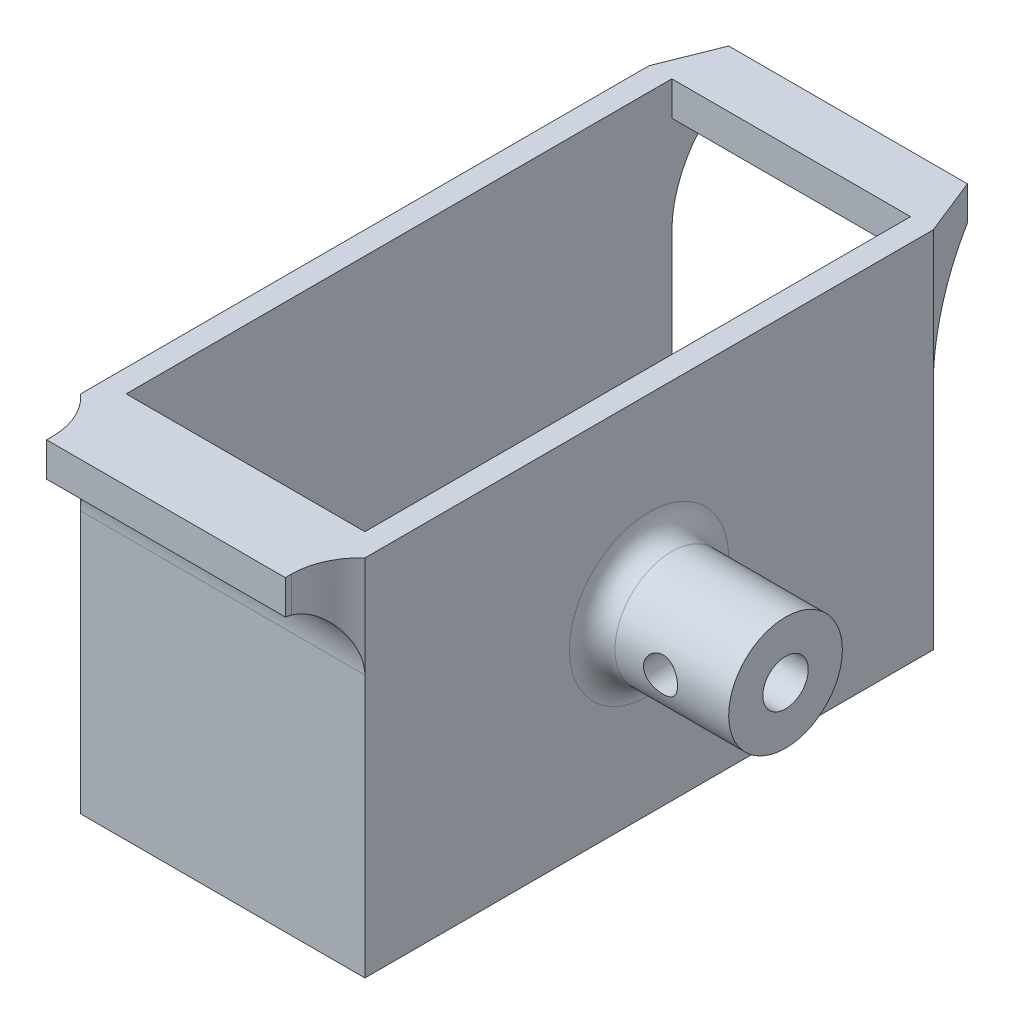
from build123d import *

# Parameters (mm, degrees)
BOSS_EXTRUDE1_DEPTH      = 29
BOSS_EXTRUDE1_DEPTH_BACK = 3
SKETCH1_W                = 25
SKETCH1_H                = 50
BOSS_EXTRUDE2_DEPTH      = 3
BOSS_EXTRUDE3_START      = 29
SKETCH1_4_W              = 21
SKETCH1_4_H              = 5
BOSS_EXTRUDE3_DEPTH      = 3
CUT_EXTRUDE1_DEPTH       = 29
FILLET1_START            = -12.900995056
FILLET1_DEPTH            = 2
FILLET1_START_2          = 10.099004944
FILLET1_2_DEPTH          = 2
FILLET1_START_3          = 16
FILLET1_3_DEPTH          = 10
FILLET2_R                = 6
SKETCH2_R                = 5
SKETCH2_R_2              = 2
BOSS_EXTRUDE4_DEPTH      = 12
CUT_EXTRUDE3_DEPTH       = 30
FILLET5_R                = 2


with BuildPart() as part:
    # Sketch1 → Boss-Extrude1 (new, two sides: drawn at the far end of the back side and taken through both)
    with BuildSketch(Plane(origin=(0, 0, 0), x_dir=(1, 0, 0), z_dir=(0, 1, 0)).offset(-BOSS_EXTRUDE1_DEPTH_BACK)):
        with Locations((-0.400995056, -2.5)):
            Rectangle(SKETCH1_W, SKETCH1_H)
    extrude(amount=BOSS_EXTRUDE1_DEPTH + BOSS_EXTRUDE1_DEPTH_BACK)

    # Sketch1<3> → Boss-Extrude2 (add)
    with BuildSketch(Plane(origin=(0, 0, 0), x_dir=(1, 0, 0), z_dir=(0, 1, 0))):
        Polygon((-10.900995056, 22.5), (-10.900995056, 20.5), (-10.900995056, -25.5), (10.099004944, -25.5), (10.099004944, 20.5), (10.099004944, 22.5), align=None)
    extrude(amount=-BOSS_EXTRUDE2_DEPTH)

    # Sketch1<4> → Boss-Extrude3 (add)
    with BuildSketch(Plane(origin=(0, 0, 0), x_dir=(1, 0, 0), z_dir=(0, 1, 0)).offset(BOSS_EXTRUDE3_START)):
        Polygon((-12.900995056, 22.5), (12.099004944, 22.5), (10.099004944, 27.5), (-10.900995056, 27.5), align=None)
        with Locations((-0.400995056, -30)):
            Rectangle(SKETCH1_4_W, SKETCH1_4_H)
    extrude(amount=-BOSS_EXTRUDE3_DEPTH)

    # Sketch1<5> → Cut-Extrude1 (cut)
    with BuildSketch(Plane(origin=(0, 0, 0), x_dir=(1, 0, 0), z_dir=(0, 1, 0))):
        Polygon((-10.900995056, 22.5), (10.099004944, 22.5), (10.099004944, 20.5), (10.099004944, -25.5), (-10.900995056, -25.5), (-10.900995056, 20.5), align=None)
    extrude(amount=CUT_EXTRUDE1_DEPTH, mode=Mode.SUBTRACT)

    # Fillet1: read off the stored shape, not the designer's step
    # Fillet1 outline → Fillet1 (add)
    with BuildSketch(Plane.YZ.offset(FILLET1_START)):
        with BuildLine():
            ThreePointArc((17.339745962, -22.5), (22.339745962, -23.839745962), (26, -27.5))
            Line((26, -27.5), (26, -22.5))
            Line((26, -22.5), (17.339745962, -22.5))
        make_face()
    extrude(amount=FILLET1_DEPTH)

    # Fillet1 2 outline → Fillet1 2 (add)
    with BuildSketch(Plane.YZ.offset(FILLET1_START_2)):
        with BuildLine():
            ThreePointArc((17.339745962, -22.5), (22.339745962, -23.839745962), (26, -27.5))
            Line((26, -27.5), (26, -22.5))
            Line((26, -22.5), (17.339745962, -22.5))
        make_face()
    extrude(amount=FILLET1_2_DEPTH)

    # Fillet1 3 outline → Fillet1 3 (cut)
    with BuildSketch(Plane(origin=(0, 0, 0), x_dir=(1, 0, 0), z_dir=(0, 1, 0)).offset(FILLET1_START_3)):
        Polygon((-13.500995056, 21), (-10.300995056, 29), (-14, 29), (-14, 21), align=None)
        Polygon((14, 29), (9.499004944, 29), (12.699004944, 21), (14, 21), align=None)
    extrude(amount=FILLET1_3_DEPTH, mode=Mode.SUBTRACT)

    # Fillet2
    # the kernel refuses this fillet: 6 mm, written as the material it adds along each edge
    with BuildSketch(Plane(origin=(10.099004944, 26, 27.5), x_dir=(0, 0, 1), z_dir=(-1, 0, 0))) as fillet2_piece_1:
        with BuildLine():
            CenterArc((6, -5.916079783), FILLET2_R, 99.594068227, 80.405931773)
            Line((0, -5.916079783), (0, 0))
            Line((0, 0), (5, 0))
        make_face()
    extrude(amount=21)
    with BuildSketch(Plane(origin=(10.099004944, 29, 27.5), x_dir=(0, 0, 1), z_dir=(0, -1, 0))) as fillet2_piece_2:
        with BuildLine():
            CenterArc((4.472135955, -6), FILLET2_R, 90, 48.189685104)
            Line((0, -2), (0, 0))
            Line((0, 0), (4.472135955, 0))
        make_face()
    extrude(amount=3)
    with BuildSketch(Plane(origin=(-10.900995056, 29, 27.5), x_dir=(0, 0, 1), z_dir=(0, -1, 0))) as fillet2_piece_3:
        with BuildLine():
            CenterArc((4.472135955, 6), FILLET2_R, 221.810314896, 48.189685104)
            Line((0, 2), (0, 0))
            Line((0, 0), (4.472135955, 0))
        make_face()
    extrude(amount=3)
    with BuildSketch(Plane(origin=(24.889204401, 26, 27.5), x_dir=(0, 0, 1), z_dir=(-1, 0, 0))) as fillet2_piece_4a_section:
        with BuildLine():
            CenterArc((6, -5.916079783), FILLET2_R, 99.594068227, 80.405931773)
            Line((0, -5.916079783), (0, 0))
            Line((0, 0), (5, 0))
        make_face()
    fillet2_piece_4a = extrude(amount=35.790199458, mode=Mode.PRIVATE)
    fillet2_piece_4a = split(fillet2_piece_4a, bisect_by=Plane(origin=(12.099004944, 26, 27.5), z_dir=(-1, 0, 0)), keep=Keep.TOP, mode=Mode.PRIVATE)
    fillet2_piece_4a = split(fillet2_piece_4a, bisect_by=Plane(origin=(10.099004944, 26, 27.5), z_dir=(1, 0, 0)), keep=Keep.TOP, mode=Mode.PRIVATE)
    with BuildSketch(Plane(origin=(10.099004944, 29, 27.5), x_dir=(0, 0, 1), z_dir=(0, -1, 0))) as fillet2_piece_4b_section:
        with BuildLine():
            CenterArc((4.472135955, -6), FILLET2_R, 90, 48.189685104)
            Line((0, -2), (0, 0))
            Line((0, 0), (4.472135955, 0))
        make_face()
    fillet2_piece_4b = extrude(amount=14.180339887, mode=Mode.PRIVATE)
    fillet2_piece_4b = split(fillet2_piece_4b, bisect_by=Plane(origin=(10.099004944, 26, 27.5), z_dir=(0, -1, 0)), keep=Keep.TOP, mode=Mode.PRIVATE)
    fillet2_piece_4 = fillet2_piece_4a & fillet2_piece_4b
    add(fillet2_piece_4)
    with BuildSketch(Plane(origin=(-10.900995056, 29, 27.5), x_dir=(0, 0, 1), z_dir=(0, -1, 0))) as fillet2_piece_5a_section:
        with BuildLine():
            CenterArc((4.472135955, 6), FILLET2_R, 221.810314896, 48.189685104)
            Line((0, 2), (0, 0))
            Line((0, 0), (4.472135955, 0))
        make_face()
    fillet2_piece_5a = extrude(amount=14.180339887, mode=Mode.PRIVATE)
    fillet2_piece_5a = split(fillet2_piece_5a, bisect_by=Plane(origin=(-10.900995056, 26, 27.5), z_dir=(0, -1, 0)), keep=Keep.TOP, mode=Mode.PRIVATE)
    with BuildSketch(Plane(origin=(10.099004944, 26, 27.5), x_dir=(0, 0, 1), z_dir=(-1, 0, 0))) as fillet2_piece_5b_section:
        with BuildLine():
            CenterArc((6, -5.916079783), FILLET2_R, 99.594068227, 80.405931773)
            Line((0, -5.916079783), (0, 0))
            Line((0, 0), (5, 0))
        make_face()
    fillet2_piece_5b = extrude(amount=35.790199458, mode=Mode.PRIVATE)
    fillet2_piece_5b = split(fillet2_piece_5b, bisect_by=Plane(origin=(-12.900995056, 26, 27.5), z_dir=(1, 0, 0)), keep=Keep.TOP, mode=Mode.PRIVATE)
    fillet2_piece_5b = split(fillet2_piece_5b, bisect_by=Plane(origin=(-10.900995056, 26, 27.5), z_dir=(-1, 0, 0)), keep=Keep.TOP, mode=Mode.PRIVATE)
    fillet2_piece_5 = fillet2_piece_5a & fillet2_piece_5b
    add(fillet2_piece_5)

    # Sketch2 → Boss-Extrude4 (add)
    with BuildSketch(Plane(origin=(12.099004944, 0, 0), x_dir=(0, 0, -1), z_dir=(1, 0, 0))):
        with Locations(Location((-2.5, 13, 0), (0, 0, 180))):
            Circle(SKETCH2_R)
        with Locations((-2.5, 13)):
            Circle(SKETCH2_R_2, mode=Mode.SUBTRACT)
    extrude(amount=BOSS_EXTRUDE4_DEPTH)

    # Sketch3 → Cut-Extrude3 (cut)
    with BuildSketch(Plane.XY.offset(27.5)):
        with BuildLine():
            ThreePointArc((19.599004944, 13), (19.159665115, 14.060660172), (18.099004944, 14.5))
            Line((18.099004944, 14.5), (18.099004944, 11.5))
            ThreePointArc((18.099004944, 11.5), (19.159665115, 11.939339828), (19.599004944, 13))
        make_face()
        with BuildLine():
            Line((18.099004944, 11.5), (18.099004944, 14.5))
            ThreePointArc((18.099004944, 14.5), (16.599004944, 13), (18.099004944, 11.5))
        make_face()
    extrude(amount=-CUT_EXTRUDE3_DEPTH, mode=Mode.SUBTRACT)

    # Fillet5
    fillet5_edges = [part.edges().sort_by_distance(p)[0] for p in [
        (12.099004944, 13, -2.5),
    ]]
    fillet(fillet5_edges, radius=FILLET5_R)


solid = part.part
